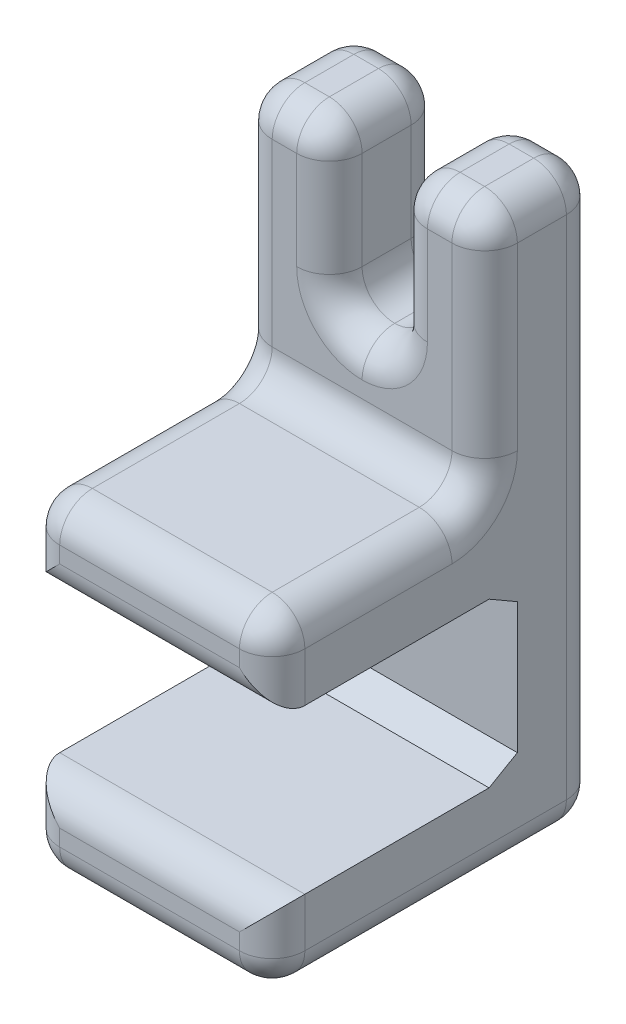
from build123d import *

# Parameters (mm, degrees)
SKETCH1_W                      = 15
SKETCH1_H                      = 35
BOSS_EXTRUDE1_DEPTH            = 20
SKETCH2_W                      = 15
SKETCH2_H                      = 10
CUT_EXTRUDE1_DEPTH             = 44.011626335
SKETCH4_W                      = 13
SKETCH4_H                      = 15
CUT_EXTRUDE3_DEPTH             = 44.011626335
CUT_EXTRUDE4_REACH             = 45.012
SKETCH5_W                      = 4
SKETCH5_H                      = 10
CUT_EXTRUDE4_DIRECTION_2_DEPTH = 44.011626335
FILLET2_R                      = 2
CHAMFER1_SIZE                  = 1
CHAMFER1_SIZE2                 = 1.732050808


with BuildPart() as part:
    # Sketch1 → Boss-Extrude1 (new body)
    with BuildSketch(Plane.XY):
        with Locations((-7.5, 17.5)):
            Rectangle(SKETCH1_W, SKETCH1_H)
    extrude(amount=BOSS_EXTRUDE1_DEPTH)

    # Sketch2 → Cut-Extrude1 (cut, through all)
    with BuildSketch(Plane(origin=(0, 0, 0), x_dir=(0, 0, -1), z_dir=(1, 0, 0))):
        with Locations((-12.5, 10)):
            Rectangle(SKETCH2_W, SKETCH2_H)
    extrude(amount=-CUT_EXTRUDE1_DEPTH, mode=Mode.SUBTRACT)

    # Sketch4 → Cut-Extrude3 (cut, through all)
    with BuildSketch(Plane.ZY.offset(15)):
        with Locations((13.5, 27.5)):
            Rectangle(SKETCH4_W, SKETCH4_H)
    extrude(amount=-CUT_EXTRUDE3_DEPTH, mode=Mode.SUBTRACT)

    # Sketch5 → Cut-Extrude4 (cut, up to next)
    with BuildSketch(Plane(origin=(0, 0, 0), x_dir=(-1, 0, 0), z_dir=(0, 0, -1)), mode=Mode.PRIVATE) as cut_extrude4_sk1:
        with Locations((7.5, 30)):
            Rectangle(SKETCH5_W, SKETCH5_H)
    cut_extrude4_tool1 = extrude(cut_extrude4_sk1.sketch, amount=-CUT_EXTRUDE4_REACH, mode=Mode.PRIVATE) & part.part
    add(cut_extrude4_tool1.solids().sort_by_distance((-7.5, 30, 0))[0], mode=Mode.SUBTRACT)

    # Sketch5 → Cut-Extrude4 direction 2 (cut)
    with BuildSketch(Plane(origin=(0, 0, 0), x_dir=(-1, 0, 0), z_dir=(0, 0, -1))):
        with Locations((7.5, 30)):
            Rectangle(SKETCH5_W, SKETCH5_H)
    extrude(amount=CUT_EXTRUDE4_DIRECTION_2_DEPTH, mode=Mode.SUBTRACT)

    # Fillet2
    fillet2_edges = [part.edges().sort_by_distance(p)[0] for p in [
        (0, 17.5, 20),
        (-15, 2.5, 20),
        (-7.5, 0, 20),
        (-7.5, 5, 20),
        (-7.5, 15, 20),
        (-15, 17.5, 20),
        (-15, 35, 3.5),
        (0, 35, 3.5),
        (0, 20, 13.5),
        (-7.5, 20, 20),
        (0, 27.5, 7),
        (-7.5, 20, 7),
        (-2.75, 35, 7),
        (-15, 27.5, 7),
        (-15, 20, 13.5),
        (-12.25, 35, 7),
        (-12.25, 35, 0),
        (-5.5, 35, 3.5),
        (-5.5, 25, 3.5),
        (-9.5, 25, 3.5),
        (-9.5, 35, 3.5),
        (-5.5, 30, 0),
        (-7.5, 25, 0),
        (-9.5, 30, 0),
        (0, 2.5, 20),
        (-7.5, 0, 0),
        (-7.5, 25, 7),
        (-5.5, 30, 7),
        (-9.5, 30, 7),
        (-15, 17.5, 0),
        (-2.75, 35, 0),
        (0, 17.5, 0),
        (0, 0, 10),
        (-15, 0, 10),
    ]]
    fillet(fillet2_edges, radius=FILLET2_R - 0.0001)  # a hair under: the kernel refuses the full size

    # Chamfer1
    chamfer1_edges = [part.edges().sort_by_distance(p)[0] for p in [
        (-7.5, 15, 5),
        (-7.5, 5, 5),
    ]]
    chamfer1_side = [part.faces().sort_by_distance(p)[0] for p in [
        (-7.5, 10, 5),
    ]]
    chamfer(chamfer1_edges, length=CHAMFER1_SIZE, length2=CHAMFER1_SIZE2, reference=chamfer1_side[0])


solid = part.part
